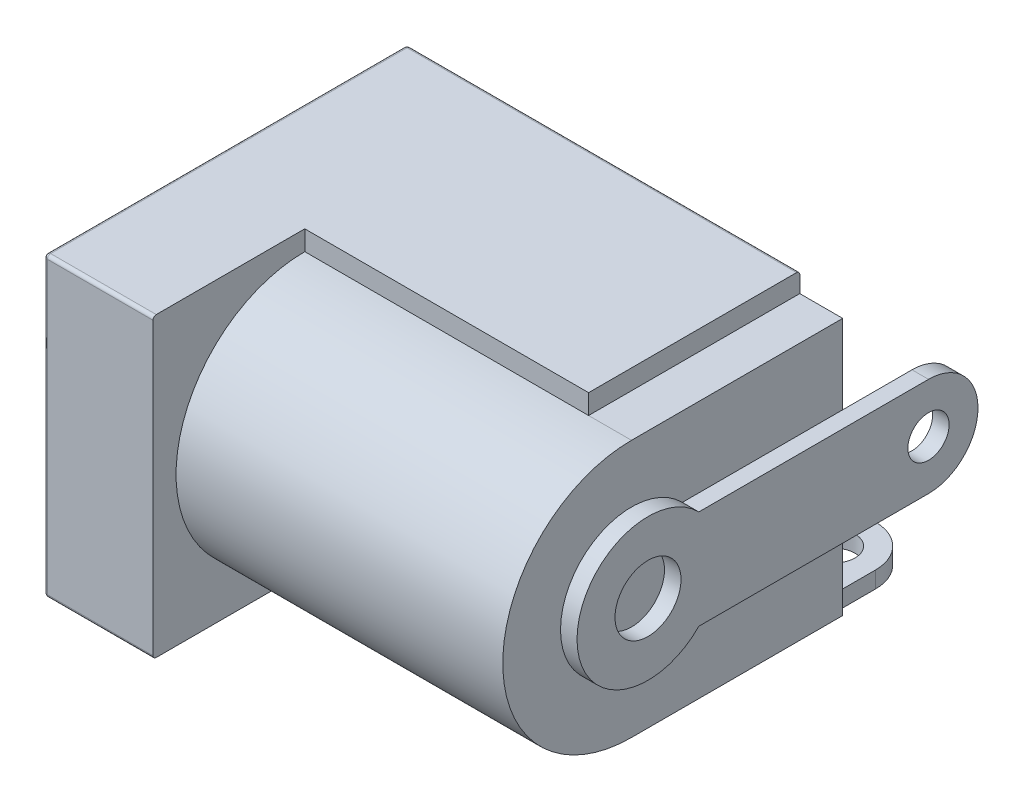
from build123d import *

# Parameters (mm, degrees)
BOSS_EXTRUDE2_DEPTH = 9.9
SKETCH2_W           = 11
SKETCH2_H           = 9
BOSS_EXTRUDE3_DEPTH = 3.3
SKETCH4_W           = 6.4
SKETCH4_H           = 9
BOSS_EXTRUDE4_DEPTH = 8.6
SKETCH3_R           = 3.15
CUT_EXTRUDE1_DEPTH  = 9.35
SKETCH6_R           = 1.5
BOSS_EXTRUDE6_DEPTH = 0.1
SKETCH5_R           = 1
BOSS_EXTRUDE5_DEPTH = 8.35
FILLET1_R           = 1
EXTRUDE_THIN2_START = -3
EXTRUDE_THIN2_DEPTH = 6
EXTRUDE_THIN3_DEPTH = 2.5
FILLET2_R           = 1.25
SKETCH9_R           = 0.625
CUT_EXTRUDE2_DEPTH  = 0.5
BOSS_EXTRUDE7_START = 0.5
SKETCH10_R          = 1
BOSS_EXTRUDE7_DEPTH = 0.5
FILLET3_R           = 1.5
SKETCH12_R          = 0.625
CUT_EXTRUDE3_DEPTH  = 0.5
SKETCH13_W          = 3.6
SKETCH13_H          = 2.5
SKETCH13_R          = 0.625
BOSS_EXTRUDE8_DEPTH = 0.15
FILLET4_R           = 1.25
FILLET5_R           = 0.1


# Read off the part's stored shape, not the designer's step: Extrude-Thin2
with BuildPart() as part:
    # Sketch1 → Boss-Extrude2 (new body)
    with BuildSketch(Plane(origin=(0, 0, 0), x_dir=(0, 0, -1), z_dir=(1, 0, 0))):
        with BuildLine():
            Line((0, 3.9), (6.4, 3.9))
            Line((6.4, 3.9), (6.4, -3.9))
            Line((6.4, -3.9), (0, -3.9))
            ThreePointArc((0, -3.9), (-3.9, 0), (0, 3.9))
        make_face()
    extrude(amount=-BOSS_EXTRUDE2_DEPTH)

    # Sketch2 → Boss-Extrude3 (add)
    with BuildSketch(Plane.ZY.offset(9.9)):
        with Locations((-0.9, 0)):
            Rectangle(SKETCH2_W, SKETCH2_H)
    extrude(amount=BOSS_EXTRUDE3_DEPTH)

    # Sketch4 → Boss-Extrude4 (add)
    with BuildSketch(Plane(origin=(-9.9, 0, 0), x_dir=(0, 0, -1), z_dir=(1, 0, 0))):
        with Locations((3.2, 0)):
            Rectangle(SKETCH4_W, SKETCH4_H)
    extrude(amount=BOSS_EXTRUDE4_DEPTH)

    # Sketch3 → Cut-Extrude1 (cut)
    with BuildSketch(Plane.ZY.offset(13.2)):
        Circle(SKETCH3_R)
    extrude(amount=-CUT_EXTRUDE1_DEPTH, mode=Mode.SUBTRACT)

    # Sketch6 → Boss-Extrude6 (add)
    with BuildSketch(Plane.ZY.offset(3.85)):
        Circle(SKETCH6_R)
    extrude(amount=BOSS_EXTRUDE6_DEPTH)

    # Sketch5 → Boss-Extrude5 (add)
    with BuildSketch(Plane.ZY.offset(3.85)):
        Circle(SKETCH5_R)
    extrude(amount=BOSS_EXTRUDE5_DEPTH)

    # Fillet1
    fillet1_edges = [part.edges().sort_by_distance(p)[0] for p in [
        (-12.2, 0, -1),
    ]]
    fillet(fillet1_edges, radius=FILLET1_R)

    # Sketch10 → Boss-Extrude7 (add)
    with BuildSketch(Plane(origin=(0, 0, 0), x_dir=(0, 0, -1), z_dir=(1, 0, 0)).offset(BOSS_EXTRUDE7_START)):
        with BuildLine():
            Line((1.54029218, -1.5), (10, -1.5))
            Line((10, -1.5), (10, 1.5))
            Line((10, 1.5), (1.54029218, 1.5))
            ThreePointArc((1.54029218, 1.5), (-2.15, 0), (1.54029218, -1.5))
        make_face()
        Circle(SKETCH10_R, mode=Mode.SUBTRACT)
    extrude(amount=-BOSS_EXTRUDE7_DEPTH)

    # Fillet3
    fillet3_edges = [part.edges().sort_by_distance(p)[0] for p in [
        (0.25, 1.5, -10),
        (0.25, -1.5, -10),
    ]]
    fillet(fillet3_edges, radius=FILLET3_R - 0.0001)  # a hair under: the kernel refuses the full size

    # Sketch12 → Cut-Extrude3 (cut)
    with BuildSketch(Plane(origin=(0.5, 0, 0), x_dir=(0, 0, -1), z_dir=(1, 0, 0))):
        with Locations((8.5, 0)):
            Circle(SKETCH12_R)
    extrude(amount=-CUT_EXTRUDE3_DEPTH, mode=Mode.SUBTRACT)

    # Sketch13 → Boss-Extrude8 (add, symmetric)
    with BuildSketch(Plane.ZY.offset(5.85)):
        with Locations((-8.2, 0)):
            Rectangle(SKETCH13_W, SKETCH13_H)
        with Locations(Location((-8.5, 0, 0), (0, 0, 180))):
            Circle(SKETCH13_R, mode=Mode.SUBTRACT)
    extrude(amount=BOSS_EXTRUDE8_DEPTH, both=True)

    # Fillet4
    fillet4_edges = [part.edges().sort_by_distance(p)[0] for p in [
        (-5.85, -1.25, -10),
        (-5.85, 1.25, -10),
    ]]
    fillet(fillet4_edges, radius=FILLET4_R - 0.0001)  # a hair under: the kernel refuses the full size

    # Fillet5
    fillet5_edges = [part.edges().sort_by_distance(p)[0] for p in [
        (-7.25, 4.5, -6.4),
        (-7.25, -4.5, -6.4),
        (-11.55, -4.5, 4.6),
        (-11.55, 4.5, 4.6),
        (-13.2, 0, -6.4),
        (-13.2, -4.5, -0.9),
        (-13.2, 0, 4.6),
        (-13.2, 4.5, -0.9),
    ]]
    fillet(fillet5_edges, radius=FILLET5_R)


with BuildPart() as body_2:
    # Extrude-Thin2 outline → Extrude-Thin2 (new body)
    with BuildSketch(Plane(origin=(0, 0, 0), x_dir=(1, 0, 0), z_dir=(0, 1, 0)).offset(EXTRUDE_THIN2_START)):
        with BuildLine():
            Line((-11.853196595, 3.139777961), (-12.052935199, 3.15))
            add(Edge.make_bspline(
                [(-12.052935199, 3.15), (-12.123286013, 1.775345384), (-9.308767384, 0.927202084), (-6.776618422, 2.924902189), (-6.014250042, 2.269230668), (-3.85, 1.960007182)],
                knots=[0, 0, 0, 0, 0.580119449, 0.680119449, 1, 1, 1, 1], degree=3))
            Line((-3.85, 1.960007182), (-3.821711703, 2.157996506))
            add(Edge.make_bspline(
                [(-11.853196595, 3.139777961), (-11.859477381, 3.017051446), (-11.842274614, 2.903305258), (-11.767226527, 2.686882966), (-11.708977162, 2.584036538), (-11.474913838, 2.292548546), (-11.238154332, 2.122105065), (-10.658483363, 1.868304427), (-10.316871729, 1.785011506), (-9.600487173, 1.730478033), (-9.225888583, 1.759065261), (-8.690663906, 1.897746504), (-8.516675338, 1.959877984), (-8.268161931, 2.078097128), (-8.188121436, 2.121674951), (-8.027449957, 2.218254569), (-7.947264051, 2.270521048), (-7.706879907, 2.427876211), (-7.545961857, 2.534742937), (-7.21163312, 2.681472678), (-7.043445259, 2.719717739), (-6.7012668, 2.737373448), (-6.528353372, 2.718205464), (-6.15420317, 2.648908427), (-5.952082723, 2.598615188), (-5.251482723, 2.424847742), (-4.657709278, 2.277442078), (-3.821711703, 2.157996506)],
                knots=[0, 0, 0, 0, 0.0625, 0.0625, 0.125, 0.125, 0.25, 0.25, 0.375, 0.375, 0.5, 0.5, 0.5625, 0.5625, 0.59375, 0.59375, 0.625, 0.625, 0.6875, 0.6875, 0.75, 0.75, 0.8125, 0.8125, 0.875, 0.875, 1, 1, 1, 1], degree=3))
        make_face()
    extrude(amount=EXTRUDE_THIN2_DEPTH)


with BuildPart() as body_3:
    # Sketch8 → Extrude-Thin3 (new body)
    with BuildSketch(Plane.ZY.offset(3.85)):
        with BuildLine():
            Line((-1.547846379, 0), (-1.547846379, -4.35))
            ThreePointArc((-1.547846379, -4.35), (-1.752871632, -4.844974747), (-2.247846379, -5.05))
            Line((-2.247846379, -5.05), (-10, -5.05))
            Line((-10, -5.05), (-10, -4.55))
            Line((-10, -4.55), (-2.247846379, -4.55))
            ThreePointArc((-2.247846379, -4.55), (-2.106425023, -4.491421356), (-2.047846379, -4.35))
            Line((-2.047846379, -4.35), (-2.047846379, 0))
            Line((-2.047846379, 0), (-1.547846379, 0))
        make_face()
    extrude(amount=-EXTRUDE_THIN3_DEPTH)

    # Fillet2
    fillet2_edges = [body_3.edges().sort_by_distance(p)[0] for p in [
        (-1.35, -4.8, -10),
        (-3.85, -4.8, -10),
    ]]
    fillet(fillet2_edges, radius=FILLET2_R - 0.0001)  # a hair under: the kernel refuses the full size

    # Sketch9 → Cut-Extrude2 (cut)
    with BuildSketch(Plane.XZ.offset(5.05)):
        with Locations(Location((-2.6, -8.75, 0), (0, 0, 270))):
            Circle(SKETCH9_R)
    extrude(amount=-CUT_EXTRUDE2_DEPTH, mode=Mode.SUBTRACT)


solid = Compound([part.part, body_2.part, body_3.part])
